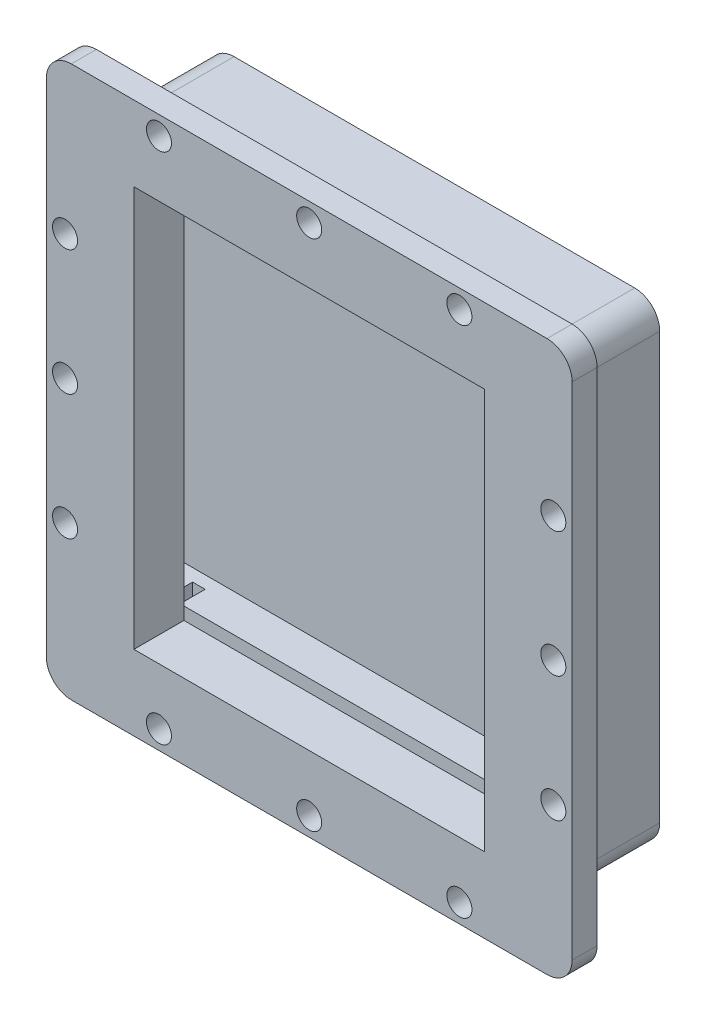
from build123d import *

# Parameters (mm, degrees)
EXTRUDE_1_DEPTH     = 40
SKETCH_7_R          = 5
EXTRUDE_2_DEPTH     = 10
SKETCH_8_W          = 140
SKETCH_8_H          = 160
CUT_EXTRUDE_4_DEPTH = 40
CUT_EXTRUDE_5_DEPTH = 160
SKETCH_10_W         = 5
SKETCH_10_H         = 5
CUT_EXTRUDE_6_DEPTH = 10


with BuildPart() as part:
    # 草图1 → 凸台-拉伸1 (new body)
    with BuildSketch(Plane.XY):
        with BuildLine():
            Line((-80, -95), (80, -95))
            ThreePointArc((80, -95), (87.071067812, -92.071067812), (90, -85))
            Line((90, -85), (90, 85))
            ThreePointArc((90, 85), (87.071067812, 92.071067812), (80, 95))
            Line((80, 95), (-80, 95))
            ThreePointArc((-80, 95), (-87.071067812, 92.071067812), (-90, 85))
            Line((-90, 85), (-90, -85))
            ThreePointArc((-90, -85), (-87.071067812, -92.071067812), (-80, -95))
        make_face()
    extrude(amount=EXTRUDE_1_DEPTH)

    # 草图7 → 凸台-拉伸2 (add)
    with BuildSketch(Plane.XY.offset(40)):
        with BuildLine():
            Line((-95, -110), (95, -110))
            ThreePointArc((95, -110), (102.071067812, -107.071067812), (105, -100))
            Line((105, -100), (105, 100))
            ThreePointArc((105, 100), (102.071067812, 107.071067812), (95, 110))
            Line((95, 110), (-95, 110))
            ThreePointArc((-95, 110), (-102.071067812, 107.071067812), (-105, 100))
            Line((-105, 100), (-105, -100))
            ThreePointArc((-105, -100), (-102.071067812, -107.071067812), (-95, -110))
        make_face()
        with Locations((0, 102.5)):
            Circle(SKETCH_7_R, mode=Mode.SUBTRACT)
        with Locations((-60, 102.5)):
            Circle(SKETCH_7_R, mode=Mode.SUBTRACT)
        with Locations((-97.5, 0)):
            Circle(SKETCH_7_R, mode=Mode.SUBTRACT)
        with Locations((-97.5, 50)):
            Circle(SKETCH_7_R, mode=Mode.SUBTRACT)
        with Locations((97.5, 0)):
            Circle(SKETCH_7_R, mode=Mode.SUBTRACT)
        with Locations((97.5, 50)):
            Circle(SKETCH_7_R, mode=Mode.SUBTRACT)
        with Locations((60, 102.5)):
            Circle(SKETCH_7_R, mode=Mode.SUBTRACT)
        with Locations((-97.5, -50)):
            Circle(SKETCH_7_R, mode=Mode.SUBTRACT)
        with Locations((97.5, -50)):
            Circle(SKETCH_7_R, mode=Mode.SUBTRACT)
        with Locations((60, -102.5)):
            Circle(SKETCH_7_R, mode=Mode.SUBTRACT)
        with Locations((0, -102.5)):
            Circle(SKETCH_7_R, mode=Mode.SUBTRACT)
        with Locations((-60, -102.5)):
            Circle(SKETCH_7_R, mode=Mode.SUBTRACT)
    extrude(amount=EXTRUDE_2_DEPTH)

    # 草图8 → 切除-拉伸4 (cut)
    with BuildSketch(Plane.XY.offset(50)):
        Rectangle(SKETCH_8_W, SKETCH_8_H)
    extrude(amount=-CUT_EXTRUDE_4_DEPTH, mode=Mode.SUBTRACT)

    # 草图5 → 切除-拉伸5 (cut)
    with BuildSketch(Plane.ZY.offset(90)):
        Polygon((10, 80), (10, -80), (25.015332606, -80), (25.015332606, -85), (30.015332606, -85), (30.015332606, -80), (30, -80), (30, 80), (30.015332606, 80), (30.015332606, 85), (25.015332606, 85), (25.015332606, 80), align=None)
    extrude(amount=-CUT_EXTRUDE_5_DEPTH, mode=Mode.SUBTRACT)

    # 草图10 → 切除-拉伸6 (cut)
    with BuildSketch(Plane.XY.offset(25.015332606)):
        with Locations((-79.041378076, 82.5)):
            Rectangle(SKETCH_10_W, SKETCH_10_H)
        with Locations((52.5, 82.5)):
            Rectangle(SKETCH_10_W, SKETCH_10_H)
        with Locations((52.5, -82.5)):
            Rectangle(SKETCH_10_W, SKETCH_10_H)
        with Locations((-79.041378076, -82.5)):
            Rectangle(SKETCH_10_W, SKETCH_10_H)
    extrude(amount=-CUT_EXTRUDE_6_DEPTH, mode=Mode.SUBTRACT)


solid = part.part
